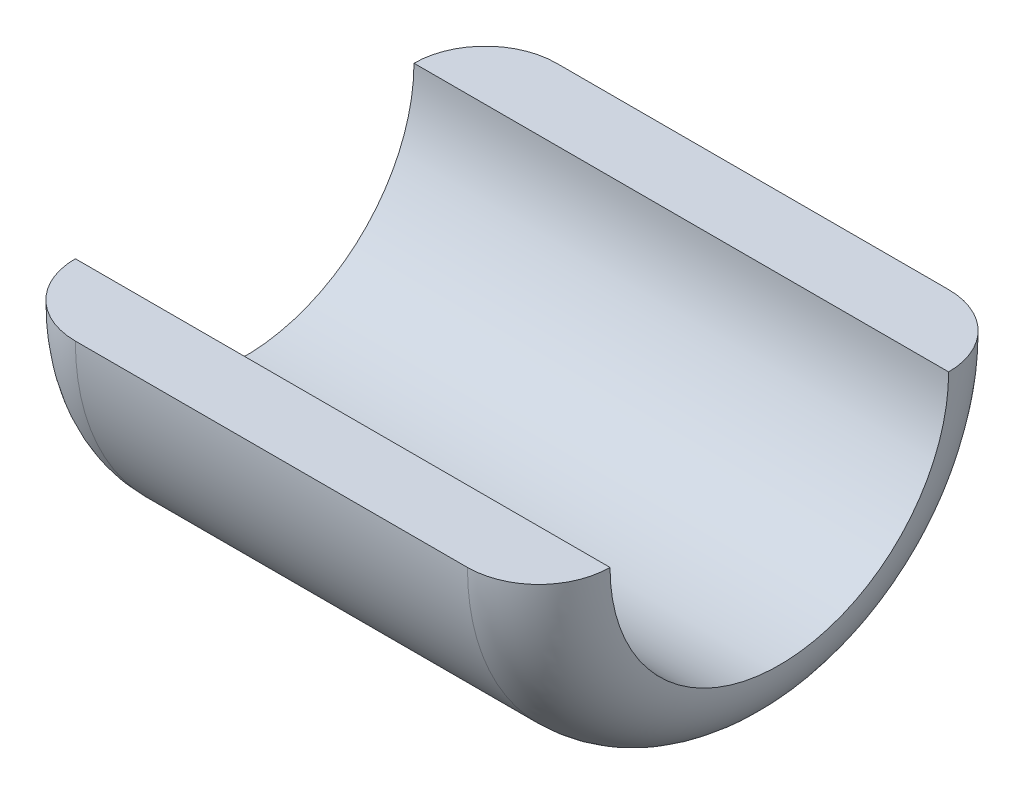
from build123d import *

# Parameters (mm, degrees)
SKETCH4_R               = 6.75
SKETCH4_R_2             = 4.75
BOSS_EXTRUDE4_DEPTH     = 15
FILLET3_R               = 2
FILLET4_R               = 2
CUT_EXTRUDE1_DEPTH      = 16.333786269
CUT_EXTRUDE1_DEPTH_BACK = 16.333786269


with BuildPart() as part:
    # Sketch4 → Boss-Extrude4 (new body)
    with BuildSketch(Plane.ZY.offset(-12)):
        with Locations(Location((0, 0, 0), (0, 0, 270))):
            Circle(SKETCH4_R)
        with Locations(Location((0, 0, 0), (0, 0, 270))):
            Circle(SKETCH4_R_2, mode=Mode.SUBTRACT)
    extrude(amount=BOSS_EXTRUDE4_DEPTH)

    # Fillet3
    fillet3_edges = [part.edges().sort_by_distance(p)[0] for p in [
        (12, 6.75, 0),
    ]]
    fillet(fillet3_edges, radius=FILLET3_R - 0.0001)  # a hair under: the kernel refuses the full size

    # Fillet4
    fillet4_edges = [part.edges().sort_by_distance(p)[0] for p in [
        (-3, 6.75, 0),
    ]]
    fillet(fillet4_edges, radius=FILLET4_R - 0.0001)  # a hair under: the kernel refuses the full size

    # Sketch5 → Cut-Extrude1 (cut, two sides: drawn at the far end of the back side and taken through both)
    with BuildSketch(Plane(origin=(0, 0, 0), x_dir=(0, 0, -1), z_dir=(1, 0, 0)).offset(-CUT_EXTRUDE1_DEPTH_BACK)):
        with BuildLine():
            ThreePointArc((6.75, 0), (0, 6.75), (-6.75, 0))
            Line((-6.75, 0), (-4.75, 0))
            ThreePointArc((-4.75, 0), (0, 4.75), (4.75, 0))
            Line((4.75, 0), (6.75, 0))
        make_face()
    extrude(amount=CUT_EXTRUDE1_DEPTH + CUT_EXTRUDE1_DEPTH_BACK, mode=Mode.SUBTRACT)


solid = part.part
